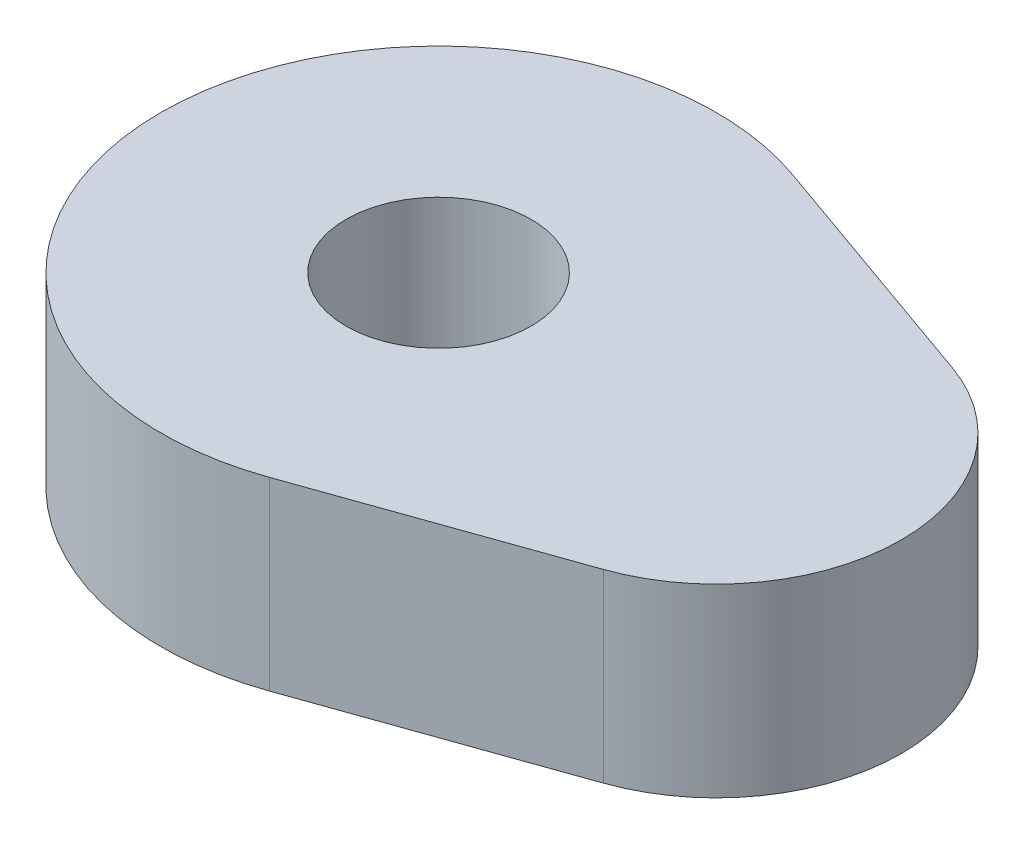
from build123d import *

# Parameters (mm, degrees)
EXTRUDE_1_DEPTH          = 10
CUT_EXTRUDE_1_DEPTH      = 31.822070015
CUT_EXTRUDE_1_DEPTH_BACK = 31.822070015
SKETCH_2_R               = 5


with BuildPart() as part:
    # 草图1 → 凸台-拉伸1 (new body)
    with BuildSketch(Plane(origin=(0, 0, 0), x_dir=(1, 0, 0), z_dir=(0, 1, 0))):
        with BuildLine():
            Line((5, 14.142135624), (18.333333333, 9.428090416))
            ThreePointArc((18.333333333, 9.428090416), (25, 0), (18.333333333, -9.428090416))
            Line((18.333333333, -9.428090416), (5, -14.142135624))
            ThreePointArc((5, -14.142135624), (-15, 0), (5, 14.142135624))
        make_face()
    extrude(amount=EXTRUDE_1_DEPTH)

    # 草图2 → 切除-拉伸1 (cut, two sides: drawn at the far end of the back side and taken through both)
    with BuildSketch(Plane(origin=(0, 10, 0), x_dir=(1, 0, 0), z_dir=(0, 1, 0)).offset(-CUT_EXTRUDE_1_DEPTH_BACK)):
        Circle(SKETCH_2_R)
    extrude(amount=CUT_EXTRUDE_1_DEPTH + CUT_EXTRUDE_1_DEPTH_BACK, mode=Mode.SUBTRACT)


solid = part.part
